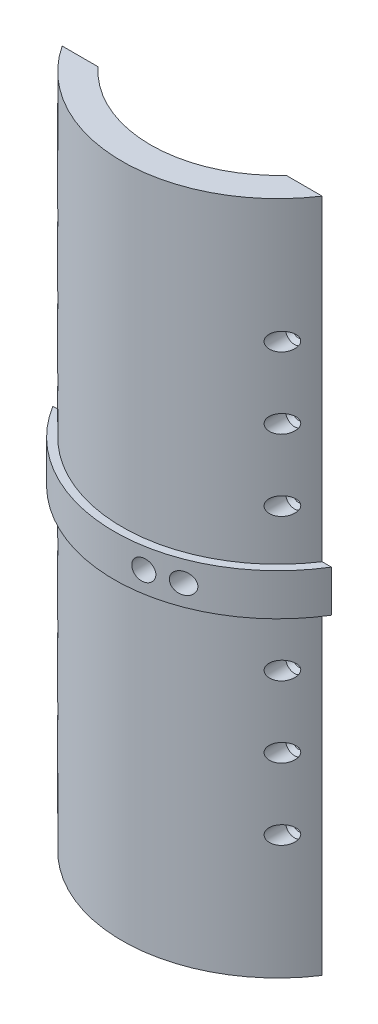
from build123d import *

# Parameters (mm, degrees)
BOSS_EXTRUDE1_DEPTH      = 218
LPATTERN1_COUNT          = 7
LPATTERN1_PITCH          = 23
BOSS_EXTRUDE2_DEPTH      = 6.731
BOSS_EXTRUDE2_DEPTH_BACK = 6.731
SKETCH9_R                = 3.334469726
CUT_EXTRUDE1_DEPTH       = 34


with BuildPart() as part:
    # Sketch1 → Boss-Extrude1 (new body)
    with BuildSketch(Plane(origin=(60.535204745, 0, -85.948449604), x_dir=(1, 0, 0), z_dir=(0, 1, 0))):
        with BuildLine():
            ThreePointArc((-30.186446753, -113.644462538), (-60.535204745, -127.035141416), (-90.883962736, -113.644462538))
            Line((-90.883962736, -113.644462538), (-102.513962844, -113.644462538))
            ThreePointArc((-102.513962844, -113.644462538), (-60.535204745, -136.240449604), (-18.556446645, -113.644462538))
            Line((-18.556446645, -113.644462538), (-30.186446753, -113.644462538))
        make_face()
    extrude(amount=BOSS_EXTRUDE1_DEPTH)

    # Sketch6 → Cut-Revolve4 (revolve, cut)
    with BuildSketch(Plane(origin=(36.163758045, 40, 27.696012934), x_dir=(-1, 0, 0), z_dir=(0, -1, 0))):
        Polygon((0, 1.685394277), (0, -4.78184701), (0, -15.185924704), (-2.9, -15.185924704), (-2.9, -3.079025683), (-1.65, -1.881964943), (-1.65, 1.685394277), align=None)
    cut_revolve4 = revolve(axis=Axis((36.163758045, 40, 26.010618657), (0, 0, 1)), mode=Mode.SUBTRACT)

    # LPattern1: Cut-Revolve4 ×7
    with Locations(*[(0, i * LPATTERN1_PITCH, 0) for i in range(1, LPATTERN1_COUNT)]):
        add(cut_revolve4, mode=Mode.SUBTRACT)

    # Mirror1: Cut-Revolve4 across plane
    add(cut_revolve4.mirror(Plane(origin=(0, 0, 0), x_dir=(0, 0, 1), z_dir=(1, 0, 0))), mode=Mode.SUBTRACT)

    # Mirror1 copy 1 sketch → Mirror1 copy 1 (revolve, cut)
    with BuildSketch(Plane(origin=(-36.163758045, 63, 27.696012934), x_dir=(1, 0, 0), z_dir=(0, -1, 0))):
        Polygon((0, -1.685394277), (0, 4.78184701), (0, 15.185924704), (-2.9, 15.185924704), (-2.9, 3.079025683), (-1.65, 1.881964943), (-1.65, -1.685394277), align=None)
    revolve(axis=Axis((-36.163758045, 63, 26.010618657), (0, 0, -1)), mode=Mode.SUBTRACT)

    # Mirror1 copy 2 sketch → Mirror1 copy 2 (revolve, cut)
    with BuildSketch(Plane(origin=(-36.163758045, 86, 27.696012934), x_dir=(1, 0, 0), z_dir=(0, -1, 0))):
        Polygon((0, -1.685394277), (0, 4.78184701), (0, 15.185924704), (-2.9, 15.185924704), (-2.9, 3.079025683), (-1.65, 1.881964943), (-1.65, -1.685394277), align=None)
    revolve(axis=Axis((-36.163758045, 86, 26.010618657), (0, 0, -1)), mode=Mode.SUBTRACT)

    # Mirror1 copy 3 sketch → Mirror1 copy 3 (revolve, cut)
    with BuildSketch(Plane(origin=(-36.163758045, 109, 27.696012934), x_dir=(1, 0, 0), z_dir=(0, -1, 0))):
        Polygon((0, -1.685394277), (0, 4.78184701), (0, 15.185924704), (-2.9, 15.185924704), (-2.9, 3.079025683), (-1.65, 1.881964943), (-1.65, -1.685394277), align=None)
    revolve(axis=Axis((-36.163758045, 109, 26.010618657), (0, 0, -1)), mode=Mode.SUBTRACT)

    # Mirror1 copy 4 sketch → Mirror1 copy 4 (revolve, cut)
    with BuildSketch(Plane(origin=(-36.163758045, 132, 27.696012934), x_dir=(1, 0, 0), z_dir=(0, -1, 0))):
        Polygon((0, -1.685394277), (0, 4.78184701), (0, 15.185924704), (-2.9, 15.185924704), (-2.9, 3.079025683), (-1.65, 1.881964943), (-1.65, -1.685394277), align=None)
    revolve(axis=Axis((-36.163758045, 132, 26.010618657), (0, 0, -1)), mode=Mode.SUBTRACT)

    # Mirror1 copy 5 sketch → Mirror1 copy 5 (revolve, cut)
    with BuildSketch(Plane(origin=(-36.163758045, 155, 27.696012934), x_dir=(1, 0, 0), z_dir=(0, -1, 0))):
        Polygon((0, -1.685394277), (0, 4.78184701), (0, 15.185924704), (-2.9, 15.185924704), (-2.9, 3.079025683), (-1.65, 1.881964943), (-1.65, -1.685394277), align=None)
    revolve(axis=Axis((-36.163758045, 155, 26.010618657), (0, 0, -1)), mode=Mode.SUBTRACT)

    # Mirror1 copy 6 sketch → Mirror1 copy 6 (revolve, cut)
    with BuildSketch(Plane(origin=(-36.163758045, 178, 27.696012934), x_dir=(1, 0, 0), z_dir=(0, -1, 0))):
        Polygon((0, -1.685394277), (0, 4.78184701), (0, 15.185924704), (-2.9, 15.185924704), (-2.9, 3.079025683), (-1.65, 1.881964943), (-1.65, -1.685394277), align=None)
    revolve(axis=Axis((-36.163758045, 178, 26.010618657), (0, 0, -1)), mode=Mode.SUBTRACT)

    # Sketch7 → Boss-Extrude2 (add, two sides: drawn at the far end of the back side and taken through both)
    with BuildSketch(Plane(origin=(0, 109, 0), x_dir=(-1, 0, 0), z_dir=(0, -1, 0)).offset(-BOSS_EXTRUDE2_DEPTH_BACK)):
        with BuildLine():
            Line((-44.990566695, -27.696012934), (-41.978758099, -27.696012934))
            ThreePointArc((-41.978758099, -27.696012934), (0, -50.292), (41.978758099, -27.696012934))
            Line((41.978758099, -27.696012934), (44.990566695, -27.696012934))
            ThreePointArc((44.990566695, -27.696012934), (0, -52.832), (-44.990566695, -27.696012934))
        make_face()
    extrude(amount=BOSS_EXTRUDE2_DEPTH + BOSS_EXTRUDE2_DEPTH_BACK)

    # Sketch9 → Cut-Extrude1 (cut)
    with BuildSketch(Plane(origin=(0, 0, 27.696012934), x_dir=(-1, 0, 0), z_dir=(0, 0, -1))):
        with Locations((-18.801989508, 109)):
            Circle(SKETCH9_R)
        with Locations((-8.69556827, 109)):
            Circle(SKETCH9_R)
    extrude(amount=-CUT_EXTRUDE1_DEPTH, mode=Mode.SUBTRACT)


solid = part.part
